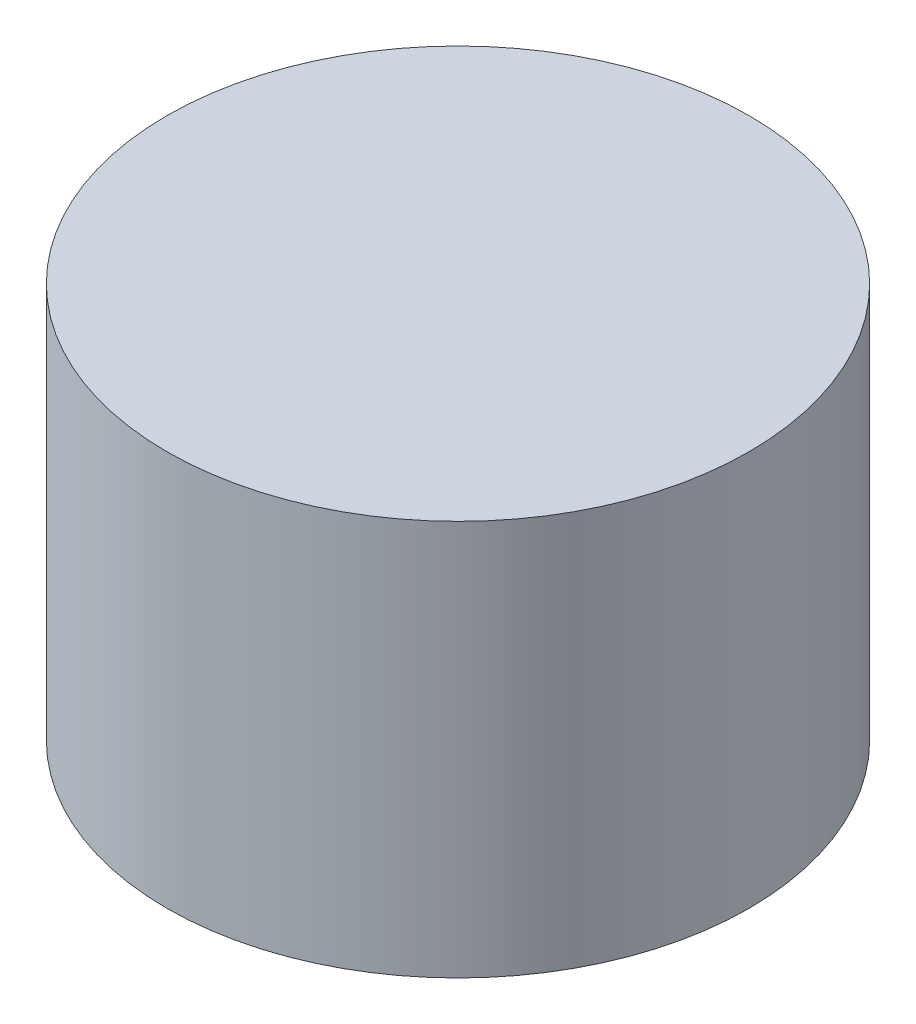
from build123d import *


with BuildPart() as part:
    # Sketch1 → Revolve1 (revolve)
    with BuildSketch(Plane.XY):
        with BuildLine():
            Line((26.5, 36), (26.5, 0))
            Line((26.5, 0), (25, 0))
            ThreePointArc((25, 0), (24, 1), (23, 0))
            Line((23, 0), (21.5, 0))
            add(Edge.make_bspline(
                [(0, 31), (21.5, 31), (21.5, 0)],
                knots=[0, 0, 0, 1, 1, 1], degree=2, weights=[1, 0.428571429, 1]))
            Line((0, 31), (0, 36))
            Line((0, 36), (26.5, 36))
        make_face()
    revolve(axis=Axis((0, 31, 0), (0, -1, 0)))


solid = part.part
